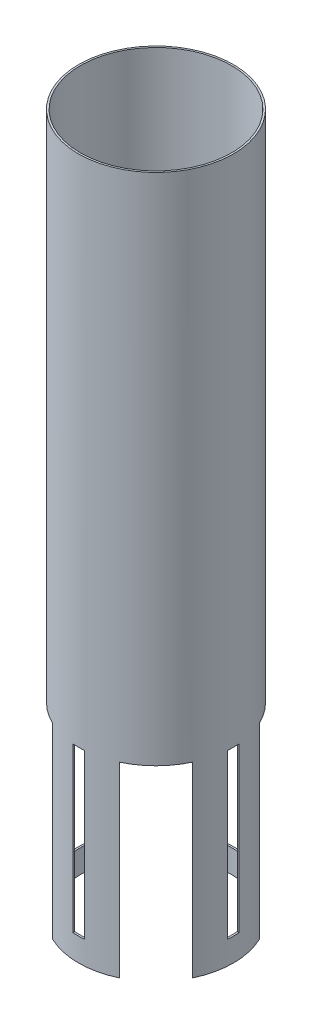
from build123d import *

# Parameters (mm, degrees)
SKETCH1_R           = 33.16
SKETCH1_R_2         = 32.385
BOSS_EXTRUDE1_DEPTH = 150
SKETCH2_W           = 5
SKETCH2_H           = 70
CUT_EXTRUDE1_DEPTH  = 158.159699669
CIRPATTERN1_COUNT   = 4
SKETCH3_W           = 22
SKETCH3_H           = 80
CUT_EXTRUDE2_DEPTH  = 165.676678618
CIRPATTERN2_COUNT   = 4


with BuildPart() as part:
    # Sketch1 → Boss-Extrude1 (new, symmetric)
    with BuildSketch(Plane(origin=(0, 0, 0), x_dir=(1, 0, 0), z_dir=(0, 1, 0))):
        Circle(SKETCH1_R)
        Circle(SKETCH1_R_2, mode=Mode.SUBTRACT)
    extrude(amount=BOSS_EXTRUDE1_DEPTH, both=True)

    # Sketch2 → Cut-Extrude1 (cut, through all)
    with BuildSketch(Plane.XY):
        with Locations((0, -105)):
            Rectangle(SKETCH2_W, SKETCH2_H)
    cut_extrude1 = extrude(amount=-CUT_EXTRUDE1_DEPTH, mode=Mode.SUBTRACT)

    # CirPattern1: Cut-Extrude1 ×4 about axis
    cirpattern1_axis = Axis((0, 150, 0), (0, -1, 0))
    for i in range(1, CIRPATTERN1_COUNT):
        add(cut_extrude1.rotate(cirpattern1_axis, i * 360 / CIRPATTERN1_COUNT), mode=Mode.SUBTRACT)

    # Sketch3 → Cut-Extrude2 (cut, through all)
    with BuildSketch(Plane(origin=(14.894180259, 0, 14.894180259), x_dir=(-0.7071067811865462, 0, 0.7071067811865489), z_dir=(-0.7071067811865489, 0, -0.7071067811865462))):
        with Locations((0, -110)):
            Rectangle(SKETCH3_W, SKETCH3_H)
    cut_extrude2 = extrude(amount=-CUT_EXTRUDE2_DEPTH, mode=Mode.SUBTRACT)

    # CirPattern2: Cut-Extrude2 ×4 about axis
    cirpattern2_axis = Axis((0, 150, 0), (0, -1, 0))
    for i in range(1, CIRPATTERN2_COUNT):
        add(cut_extrude2.rotate(cirpattern2_axis, i * 360 / CIRPATTERN2_COUNT), mode=Mode.SUBTRACT)


solid = part.part
